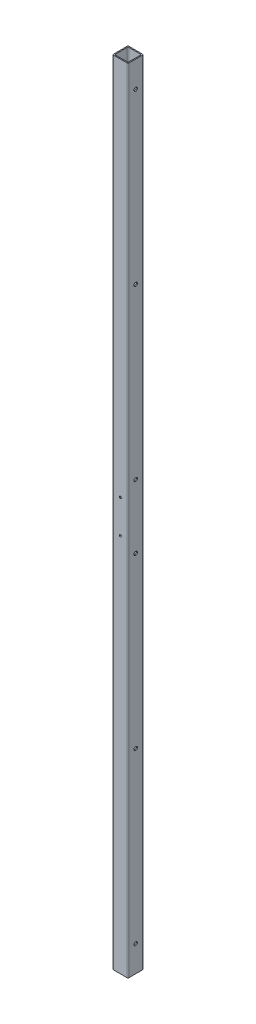
from build123d import *

# Parameters (mm, degrees)
SKETCH1_W                  = 25.4
SKETCH1_H                  = 25.4
SKETCH1_W_2                = 22.098
SKETCH1_H_2                = 22.098
BOSS_EXTRUDE1_DEPTH        = 1309.624
FILLET1_R                  = 1.27
F_1_0_228_DIAMETER_HOLE1_D = 5.7912
F_8_32_TAPPED_HOLE1_D      = 3.4544


with BuildPart() as part:
    # Sketch1 → Boss-Extrude1 (new body)
    with BuildSketch(Plane(origin=(0, 0, 0), x_dir=(1, 0, 0), z_dir=(0, 1, 0))):
        Rectangle(SKETCH1_W, SKETCH1_H)
        Rectangle(SKETCH1_W_2, SKETCH1_H_2, mode=Mode.SUBTRACT)
    extrude(amount=BOSS_EXTRUDE1_DEPTH)

    # Fillet1
    fillet1_edges = [part.edges().sort_by_distance(p)[0] for p in [
        (-12.7, 654.812, 12.7),
        (-12.7, 654.812, -12.7),
        (12.7, 654.812, -12.7),
        (12.7, 654.812, 12.7),
        (-11.049, 654.812, -11.049),
        (11.049, 654.812, 11.049),
        (11.049, 654.812, -11.049),
        (-11.049, 654.812, 11.049),
    ]]
    fillet(fillet1_edges, radius=FILLET1_R)

    # #1 (0.228) Diameter Hole1 (through all)
    with Locations(Plane(origin=(12.7, 0, 0), x_dir=(0, 0, -1), z_dir=(1, 0, 0))):
        with Locations((0, 601.98), (0, 1266.444), (0, 987.044), (0, 707.644), (0, 43.18), (0, 322.58)):
            Hole(F_1_0_228_DIAMETER_HOLE1_D / 2)

    # #8-32 Tapped Hole1 (through all)
    with Locations(Plane(origin=(0, 0, -12.7), x_dir=(-1, 0, 0), z_dir=(0, 0, -1))):
        with Locations((0, 627.38), (0, 682.244)):
            Hole(F_8_32_TAPPED_HOLE1_D / 2)


solid = part.part
